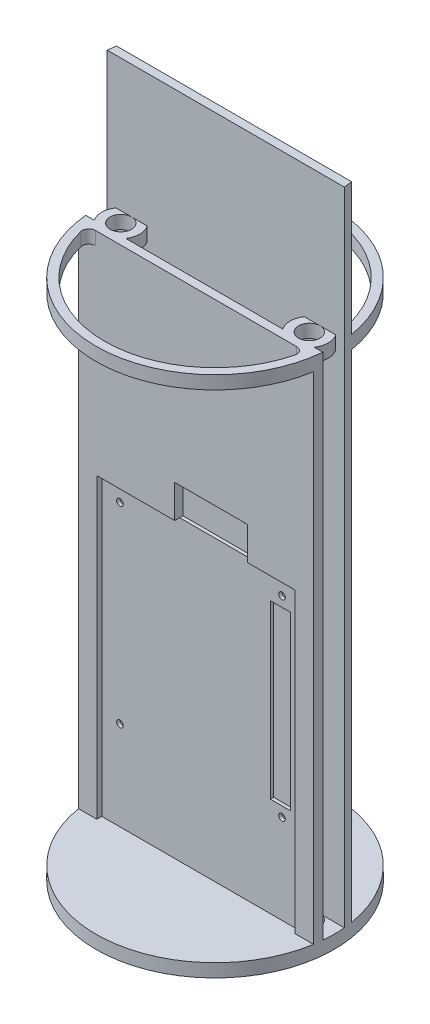
from build123d import *

# Parameters (mm, degrees)
SKETCH1_R           = 36
BOSS_EXTRUDE1_DEPTH = 4
BOSS_EXTRUDE2_DEPTH = 90
SKETCH4_R           = 3.25
CUT_EXTRUDE2_DEPTH  = 10
SKETCH3_W           = 60
SKETCH3_H           = 1.5
CUT_EXTRUDE1_DEPTH  = 90
SKETCH6_W           = 6
SKETCH6_H           = 52
CUT_EXTRUDE4_DEPTH  = 5
SKETCH7_R           = 1
CUT_EXTRUDE5_DEPTH  = 5
BOSS_EXTRUDE3_DEPTH = 60
SKETCH10_W          = 22
SKETCH10_H          = 10
CUT_EXTRUDE6_DEPTH  = 5
SKETCH8_R           = 1.5
CUT_EXTRUDE7_DEPTH  = 5
SKETCH11_R          = 3.25
BOSS_EXTRUDE4_DEPTH = 4
BOSS_EXTRUDE5_DEPTH = 40


with BuildPart() as part:
    # Sketch1 → Boss-Extrude1 (new body)
    with BuildSketch(Plane(origin=(0, 0, 0), x_dir=(1, 0, 0), z_dir=(0, 1, 0))):
        Circle(SKETCH1_R)
    extrude(amount=BOSS_EXTRUDE1_DEPTH)

    # Sketch2 → Boss-Extrude2 (add)
    with BuildSketch(Plane(origin=(0, 4, 0), x_dir=(1, 0, 0), z_dir=(0, 1, 0))):
        with BuildLine():
            ThreePointArc((35.537831954, -5.75), (35.717295076, -4.50275832), (35.85299848, -3.25))
            Line((35.85299848, -3.25), (-35.85299848, -3.25))
            ThreePointArc((-35.85299848, -3.25), (-35.717295076, -4.50275832), (-35.537831954, -5.75))
            Line((-35.537831954, -5.75), (35.537831954, -5.75))
        make_face()
        with BuildLine():
            ThreePointArc((35.85299848, 3.25), (35.717295076, 4.50275832), (35.537831954, 5.75))
            Line((35.537831954, 5.75), (-35.537831954, 5.75))
            ThreePointArc((-35.537831954, 5.75), (-35.717295076, 4.50275832), (-35.85299848, 3.25))
            Line((-35.85299848, 3.25), (35.85299848, 3.25))
        make_face()
    extrude(amount=BOSS_EXTRUDE2_DEPTH)

    # Sketch4 → Cut-Extrude2 (cut)
    with BuildSketch(Plane(origin=(0, 4, 0), x_dir=(1, 0, 0), z_dir=(0, 1, 0))):
        with Locations((-28.5, 0)):
            Circle(SKETCH4_R)
        with Locations((28.5, 0)):
            Circle(SKETCH4_R)
    extrude(amount=-CUT_EXTRUDE2_DEPTH, mode=Mode.SUBTRACT)

    # Sketch3 → Cut-Extrude1 (cut)
    with BuildSketch(Plane(origin=(0, 94, 0), x_dir=(1, 0, 0), z_dir=(0, 1, 0))):
        with Locations((0, -5)):
            Rectangle(SKETCH3_W, SKETCH3_H)
    extrude(amount=-CUT_EXTRUDE1_DEPTH, mode=Mode.SUBTRACT)

    # Sketch6 → Cut-Extrude4 (cut)
    with BuildSketch(Plane.XY.offset(4.25)):
        with Locations((24, 60)):
            Rectangle(SKETCH6_W, SKETCH6_H)
    extrude(amount=-CUT_EXTRUDE4_DEPTH, mode=Mode.SUBTRACT)

    # Sketch7 → Cut-Extrude5 (cut)
    with BuildSketch(Plane.XY.offset(4.25)):
        with Locations((-24.5, 89)):
            Circle(SKETCH7_R)
        with Locations((24.5, 89)):
            Circle(SKETCH7_R)
        with Locations((24.5, 31)):
            Circle(SKETCH7_R)
        with Locations((-24.5, 31)):
            Circle(SKETCH7_R)
    extrude(amount=-CUT_EXTRUDE5_DEPTH, mode=Mode.SUBTRACT)

    # Sketch9 → Boss-Extrude3 (add)
    with BuildSketch(Plane(origin=(0, 94, 0), x_dir=(1, 0, 0), z_dir=(0, 1, 0))):
        with BuildLine():
            Line((-35.85299848, 3.25), (35.85299848, 3.25))
            ThreePointArc((35.85299848, 3.25), (35.717295076, 4.50275832), (35.537831954, 5.75))
            Line((35.537831954, 5.75), (-35.537831954, 5.75))
            ThreePointArc((-35.537831954, 5.75), (-35.717295076, 4.50275832), (-35.85299848, 3.25))
        make_face()
        with BuildLine():
            Line((-35.537831954, -5.75), (35.537831954, -5.75))
            ThreePointArc((35.537831954, -5.75), (35.717295076, -4.50275832), (35.85299848, -3.25))
            Line((35.85299848, -3.25), (-35.85299848, -3.25))
            ThreePointArc((-35.85299848, -3.25), (-35.717295076, -4.50275832), (-35.537831954, -5.75))
        make_face()
    extrude(amount=BOSS_EXTRUDE3_DEPTH)

    # Sketch10 → Cut-Extrude6 (cut)
    with BuildSketch(Plane.XY.offset(5.75)):
        with Locations((4.537831954, 99)):
            Rectangle(SKETCH10_W, SKETCH10_H)
    extrude(amount=-CUT_EXTRUDE6_DEPTH, mode=Mode.SUBTRACT)

    # Sketch8 → Cut-Extrude7 (cut)
    with BuildSketch(Plane(origin=(0, 0, -5.75), x_dir=(-1, 0, 0), z_dir=(0, 0, -1))):
        with Locations((-26.537831954, 117)):
            Circle(SKETCH8_R)
        with Locations((17.462168046, 117)):
            Circle(SKETCH8_R)
        with Locations((17.462168046, 29)):
            Circle(SKETCH8_R)
        with Locations((-26.537831954, 29)):
            Circle(SKETCH8_R)
    extrude(amount=-CUT_EXTRUDE7_DEPTH, mode=Mode.SUBTRACT)

    # Sketch11 → Boss-Extrude4 (add)
    with BuildSketch(Plane(origin=(0, 154, 0), x_dir=(1, 0, 0), z_dir=(0, 1, 0))):
        with BuildLine():
            Line((-35.85299848, 3.25), (-33.24341649, 3.25))
            ThreePointArc((-33.24341649, 3.25), (-34.25, 0), (-33.24341649, -3.25))
            Line((-33.24341649, -3.25), (-35.85299848, -3.25))
            ThreePointArc((-35.85299848, -3.25), (0, -36), (35.85299848, -3.25))
            Line((35.85299848, -3.25), (33.24341649, -3.25))
            ThreePointArc((33.24341649, -3.25), (34.25, 0), (33.24341649, 3.25))
            Line((33.24341649, 3.25), (35.85299848, 3.25))
            ThreePointArc((35.85299848, 3.25), (0, 36), (-35.85299848, 3.25))
        make_face()
        with BuildLine():
            Line((30.430529424, 5.75), (-30.430529424, 5.75))
            ThreePointArc((-30.430529424, 5.75), (-32.009643299, 6.522645378), (-32.368662138, 8.243600631))
            ThreePointArc((-32.368662138, 8.243600631), (0, 33.401904735), (32.368662138, 8.243600631))
            ThreePointArc((32.368662138, 8.243600631), (32.009643299, 6.522645378), (30.430529424, 5.75))
        make_face(mode=Mode.SUBTRACT)
        with BuildLine():
            Line((-23.75658351, 3.25), (23.75658351, 3.25))
            ThreePointArc((23.75658351, 3.25), (22.75, 0), (23.75658351, -3.25))
            Line((23.75658351, -3.25), (-23.75658351, -3.25))
            ThreePointArc((-23.75658351, -3.25), (-22.75, 0), (-23.75658351, 3.25))
        make_face(mode=Mode.SUBTRACT)
        with BuildLine():
            ThreePointArc((32.368662138, -8.243600631), (0, -33.401904735), (-32.368662138, -8.243600631))
            ThreePointArc((-32.368662138, -8.243600631), (-32.009643299, -6.522645378), (-30.430529424, -5.75))
            Line((-30.430529424, -5.75), (30.430529424, -5.75))
            ThreePointArc((30.430529424, -5.75), (32.009643299, -6.522645378), (32.368662138, -8.243600631))
        make_face(mode=Mode.SUBTRACT)
        with Locations((28.5, 0)):
            Circle(SKETCH11_R, mode=Mode.SUBTRACT)
        with Locations((-28.5, 0)):
            Circle(SKETCH11_R, mode=Mode.SUBTRACT)
    extrude(amount=BOSS_EXTRUDE4_DEPTH)

    # Sketch12 → Boss-Extrude5 (add)
    with BuildSketch(Plane(origin=(0, 158, 0), x_dir=(1, 0, 0), z_dir=(0, 1, 0))):
        with BuildLine():
            Line((-35.85299848, 3.25), (35.85299848, 3.25))
            ThreePointArc((35.85299848, 3.25), (35.717295076, 4.50275832), (35.537831954, 5.75))
            Line((35.537831954, 5.75), (-35.537831954, 5.75))
            ThreePointArc((-35.537831954, 5.75), (-35.717295076, 4.50275832), (-35.85299848, 3.25))
        make_face()
    extrude(amount=BOSS_EXTRUDE5_DEPTH)


solid = part.part
